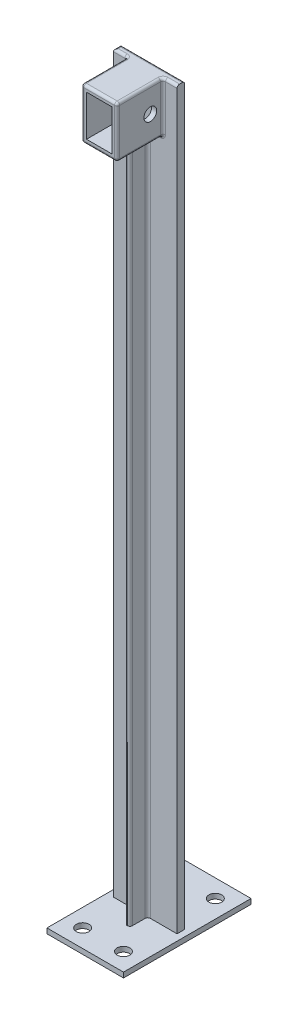
from build123d import *

# Parameters (mm, degrees)
SKETCH1_W               = 25
SKETCH1_H               = 3
BOSS_EXTRUDE1_DEPTH     = 288
SKETCH2_W               = 14
SKETCH2_H               = 20
SKETCH2_W_2             = 10
SKETCH2_H_2             = 16
BOSS_EXTRUDE2_DEPTH     = 18
CUT_EXTRUDE1_DEPTH      = 290.317299863
CUT_EXTRUDE1_DEPTH_BACK = 290.317299863
SKETCH3_R               = 2.5
SKETCH4_W               = 30
SKETCH4_H               = 50
BOSS_EXTRUDE3_DEPTH     = 2
BOSS_EXTRUDE4_DEPTH     = 7
FILLET1_R               = 1
SKETCH6_R               = 2.5
CUT_EXTRUDE2_DEPTH      = 10


with BuildPart() as part:
    # Sketch1 → Boss-Extrude1 (new body)
    with BuildSketch(Plane(origin=(0, 0, 0), x_dir=(1, 0, 0), z_dir=(0, 1, 0))):
        Rectangle(SKETCH1_W, SKETCH1_H)
    extrude(amount=BOSS_EXTRUDE1_DEPTH)

    # Sketch2 → Boss-Extrude2 (add)
    with BuildSketch(Plane.XY.offset(1.5)):
        with Locations((0, 278)):
            Rectangle(SKETCH2_W, SKETCH2_H)
        with Locations((0, 278)):
            Rectangle(SKETCH2_W_2, SKETCH2_H_2, mode=Mode.SUBTRACT)
    extrude(amount=BOSS_EXTRUDE2_DEPTH)

    # Sketch3 → Cut-Extrude1 (cut, two sides: drawn at the far end of the back side and taken through both)
    with BuildSketch(Plane.ZY.offset(7).offset(-CUT_EXTRUDE1_DEPTH_BACK)):
        with Locations(Location((6.5, 278, 0), (0, 0, 180))):
            Circle(SKETCH3_R)
    extrude(amount=CUT_EXTRUDE1_DEPTH + CUT_EXTRUDE1_DEPTH_BACK, mode=Mode.SUBTRACT)

    # Sketch4 → Boss-Extrude3 (add)
    with BuildSketch(Plane(origin=(0, 0, 0), x_dir=(-1, 0, 0), z_dir=(0, -1, 0))):
        Rectangle(SKETCH4_W, SKETCH4_H)
    extrude(amount=BOSS_EXTRUDE3_DEPTH)

    # Sketch5 → Boss-Extrude4 (add)
    with BuildSketch(Plane.XY.offset(1.5)):
        Polygon((0, 0), (1, 0), (1, 268), (0, 268), (-1, 268), (-1, 0), align=None)
    extrude(amount=BOSS_EXTRUDE4_DEPTH)

    # Fillet1
    fillet1_edges = [part.edges().sort_by_distance(p)[0] for p in [
        (-12.5, 288, 0),
        (9.75, 288, 1.5),
        (-9.75, 288, 1.5),
        (7, 278, 19.5),
        (0, 288, 19.5),
        (-7, 278, 19.5),
        (0, 268, 19.5),
        (7, 278, 1.5),
        (7, 268, 10.5),
        (7, 288, 10.5),
        (-7, 278, 1.5),
        (-7, 288, 10.5),
        (-4, 268, 1.5),
        (-7, 268, 10.5),
        (4, 268, 1.5),
        (1, 134, 1.5),
        (1, 268, 5),
        (-1, 134, 1.5),
        (-1, 268, 5),
        (1, 134, 8.5),
        (0, 268, 8.5),
        (-1, 134, 8.5),
        (0, 288, -1.5),
    ]]
    fillet(fillet1_edges, radius=FILLET1_R - 0.0001)  # a hair under: the kernel refuses the full size

    # Sketch6 → Cut-Extrude2 (cut)
    with BuildSketch(Plane(origin=(0, 0, 0), x_dir=(1, 0, 0), z_dir=(0, 1, 0))):
        with Locations(Location((8, 18, 0), (0, 0, 270))):
            Circle(SKETCH6_R)
        with Locations(Location((-8, 18, 0), (0, 0, 270))):
            Circle(SKETCH6_R)
        with Locations(Location((-8, -18, 0), (0, 0, 270))):
            Circle(SKETCH6_R)
        with Locations(Location((8, -18, 0), (0, 0, 270))):
            Circle(SKETCH6_R)
    extrude(amount=-CUT_EXTRUDE2_DEPTH, mode=Mode.SUBTRACT)


solid = part.part
